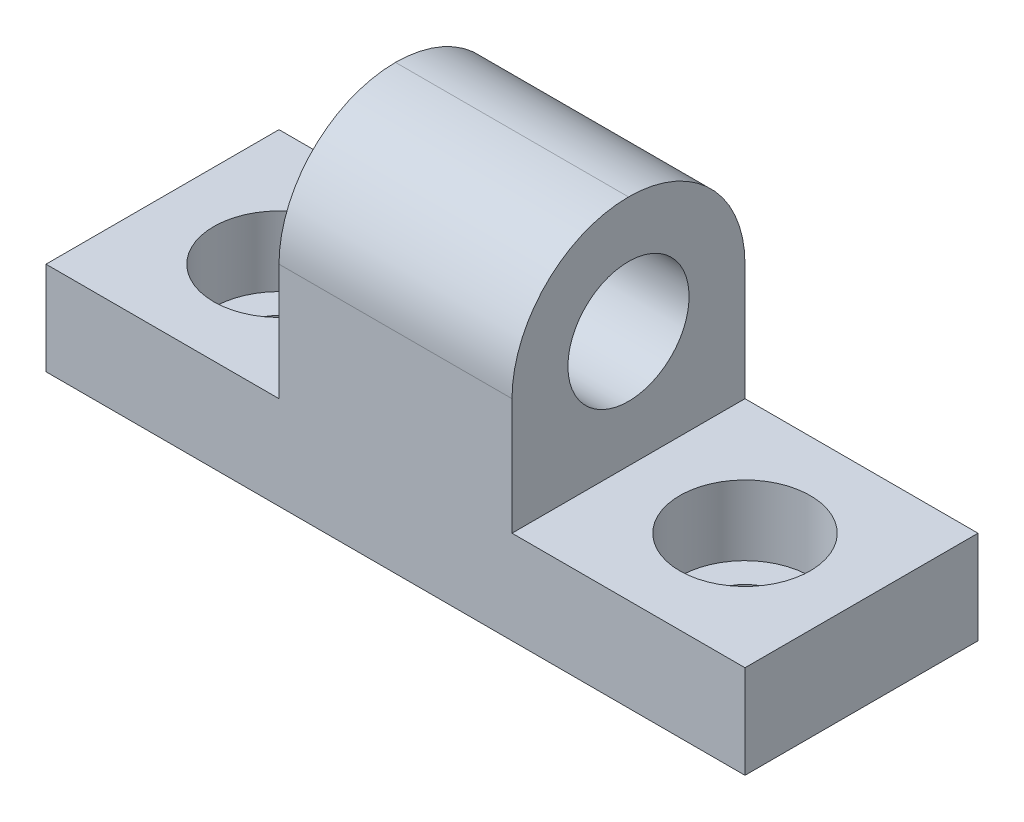
from build123d import *

# Parameters (mm, degrees)
CROQUIS1_W              = 30
CROQUIS1_H              = 10
CROQUIS1_R              = 1.55
SALIENTE_EXTRUIR1_DEPTH = 4
CROQUIS2_R              = 2.8
CORTAR_EXTRUIR1_DEPTH   = 3
CROQUIS3_W              = 10
CROQUIS3_H              = 10
SALIENTE_EXTRUIR2_DEPTH = 10
CROQUIS4_R              = 2.6
CORTAR_EXTRUIR2_DEPTH   = 10
REDONDEO3_R             = 5


with BuildPart() as part:
    # Croquis1 → Saliente-Extruir1 (new body)
    with BuildSketch(Plane(origin=(0, 0, 0), x_dir=(1, 0, 0), z_dir=(0, 1, 0))):
        with Locations((15, 5)):
            Rectangle(CROQUIS1_W, CROQUIS1_H)
        with Locations(Location((5, 5, 0), (0, 0, 270))):
            Circle(CROQUIS1_R, mode=Mode.SUBTRACT)
        with Locations(Location((25, 5, 0), (0, 0, 270))):
            Circle(CROQUIS1_R, mode=Mode.SUBTRACT)
    extrude(amount=SALIENTE_EXTRUIR1_DEPTH)

    # Croquis2 → Cortar-Extruir1 (cut)
    with BuildSketch(Plane(origin=(0, 4, 0), x_dir=(1, 0, 0), z_dir=(0, 1, 0))):
        with Locations(Location((5, 5, 0), (0, 0, 270))):
            Circle(CROQUIS2_R)
        with Locations(Location((25, 5, 0), (0, 0, 270))):
            Circle(CROQUIS2_R)
    extrude(amount=-CORTAR_EXTRUIR1_DEPTH, mode=Mode.SUBTRACT)

    # Croquis3 → Saliente-Extruir2 (add)
    with BuildSketch(Plane(origin=(0, 4, 0), x_dir=(1, 0, 0), z_dir=(0, 1, 0))):
        with Locations((15, 5)):
            Rectangle(CROQUIS3_W, CROQUIS3_H)
    extrude(amount=SALIENTE_EXTRUIR2_DEPTH)

    # Croquis4 → Cortar-Extruir2 (cut)
    with BuildSketch(Plane.ZY.offset(-10)):
        with Locations((-5, 9)):
            Circle(CROQUIS4_R)
    extrude(amount=-CORTAR_EXTRUIR2_DEPTH, mode=Mode.SUBTRACT)

    # Redondeo3
    redondeo3_edges = [part.edges().sort_by_distance(p)[0] for p in [
        (15, 14, 0),
        (15, 14, -10),
    ]]
    fillet(redondeo3_edges, radius=REDONDEO3_R - 0.0001)  # a hair under: the kernel refuses the full size


solid = part.part
